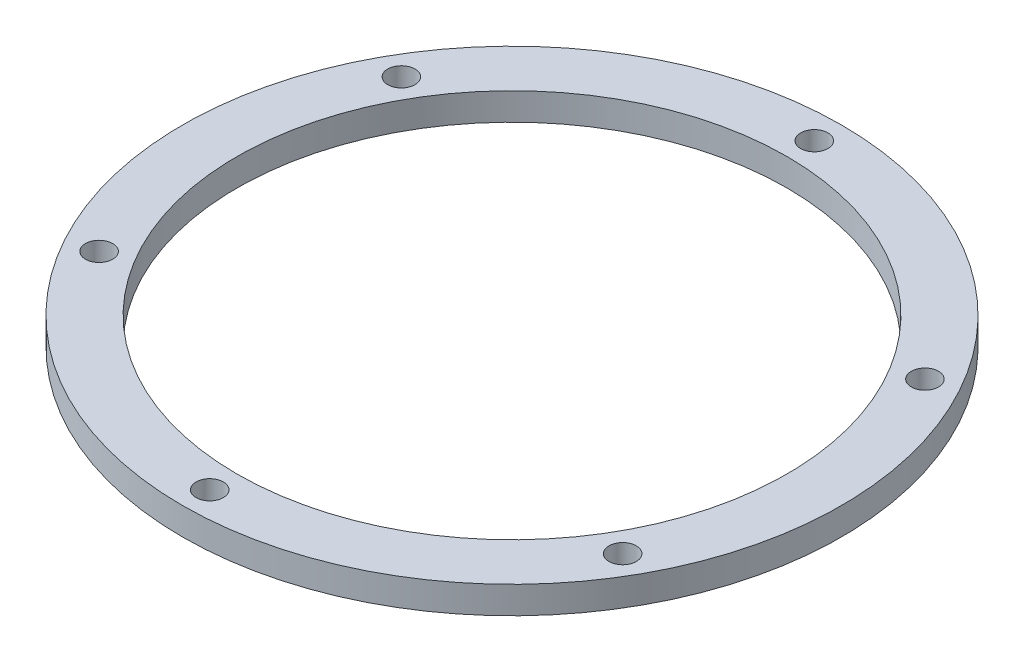
from build123d import *

# Parameters (mm, degrees)
SKETCH1_R           = 36.25
SKETCH1_R_2         = 30.25
BOSS_EXTRUDE1_DEPTH = 3
SKETCH2_R           = 1.5
CUT_EXTRUDE1_DEPTH  = 52.352945388
CIRPATTERN1_COUNT   = 6


with BuildPart() as part:
    # Sketch1 → Boss-Extrude1 (new body)
    with BuildSketch(Plane(origin=(0, 0, 0), x_dir=(1, 0, 0), z_dir=(0, 1, 0))):
        Circle(SKETCH1_R)
        Circle(SKETCH1_R_2, mode=Mode.SUBTRACT)
    extrude(amount=BOSS_EXTRUDE1_DEPTH)

    # Sketch2 → Cut-Extrude1 (cut, symmetric)
    with BuildSketch(Plane(origin=(0, 3, 0), x_dir=(1, 0, 0), z_dir=(0, 1, 0))):
        with Locations((0, 33.25)):
            Circle(SKETCH2_R)
    cut_extrude1 = extrude(amount=CUT_EXTRUDE1_DEPTH, both=True, mode=Mode.SUBTRACT)

    # CirPattern1: Cut-Extrude1 ×6 about axis
    cirpattern1_axis = Axis((0, 3, 0), (0, -1, 0))
    for i in range(1, CIRPATTERN1_COUNT):
        add(cut_extrude1.rotate(cirpattern1_axis, i * 360 / CIRPATTERN1_COUNT), mode=Mode.SUBTRACT)


solid = part.part
